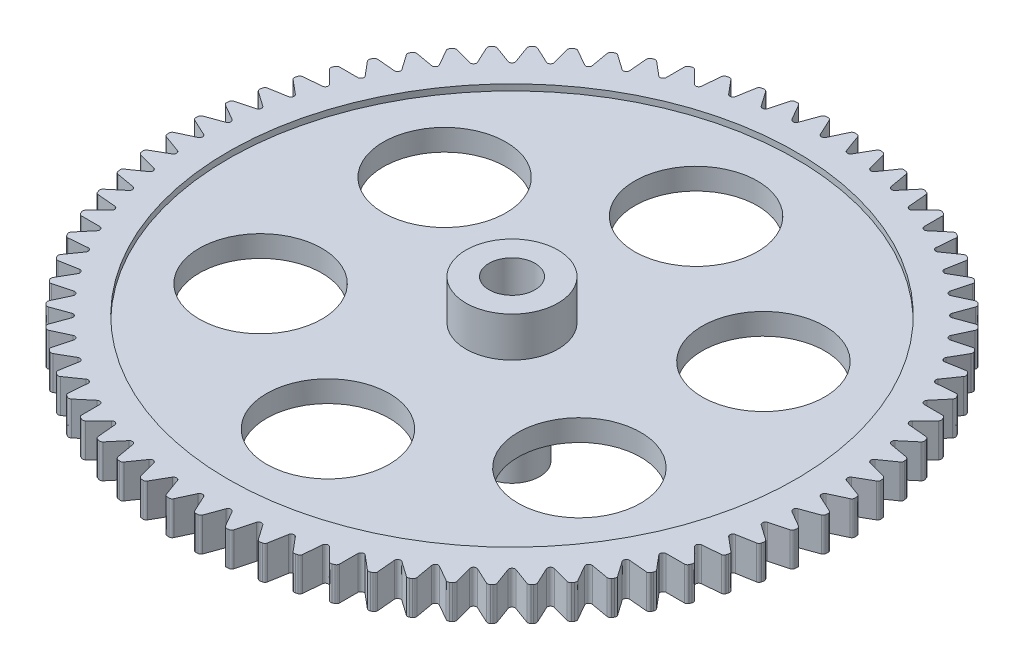
from build123d import *

# Parameters (mm, degrees)
CUT_EXTRUDE1_DEPTH  = 16.321063932
FILLET1_R           = 0.1
CIRPATTERN1_START   = 0.8
CIRPATTERN1_DEPTH   = 1.1
SKETCH3_R           = 2
CUT_EXTRUDE2_DEPTH  = 16.285192352
CIRPATTERN2_COUNT   = 6
BOSS_EXTRUDE1_START = -0.5
SKETCH6_R           = 1.5
SKETCH6_R_2         = 0.4
BOSS_EXTRUDE1_DEPTH = 0.5
BOSS_EXTRUDE2_START = 2.2
SKETCH7_R           = 0.9
SKETCH7_R_2         = 0.4
BOSS_EXTRUDE2_DEPTH = 2.2


# Read off the part's stored shape, not the designer's step: CirPattern1
with BuildPart() as part:
    # Sketch1 → Revolve1 (revolve)
    with BuildSketch(Plane.XY, mode=Mode.PRIVATE) as revolve1_sk:
        Polygon((0.5, 0), (0.5, 0.5), (0.75, 0.5), (0.75, 3), (1.5, 3), (1.5, 1.7), (9.25, 1.7), (9.25, 1.9), (10.75, 1.9), (10.75, 0.8), (9.25, 0.8), (9.25, 1), (1.5, 1), (1.5, 0), align=None)
    revolve(revolve1_sk.sketch.rotate(Axis((0, 55, 0), (0, -1, 0)), 90), axis=Axis((0, 55, 0), (0, -1, 0)))

    # Sketch2 → Cut-Extrude1 (cut, through all)
    with BuildSketch(Plane(origin=(0, 1.9, 0), x_dir=(1, 0, 0), z_dir=(0, 1, 0))):
        Polygon((-0.373046127, 10.75), (0, 9.95), (0.373046127, 10.75), align=None)
    extrude(amount=-CUT_EXTRUDE1_DEPTH, mode=Mode.SUBTRACT)

    # Fillet1
    fillet1_edges = [part.edges().sort_by_distance(p)[0] for p in [
        (0.370074857, 1.35, -10.743628093),
        (-0.370074857, 1.35, -10.743628093),
        (0, 1.35, -9.95),
    ]]
    fillet(fillet1_edges, radius=FILLET1_R)

    # CirPattern1 outline → CirPattern1 (cut)
    with BuildSketch(Plane(origin=(0, 0, 0), x_dir=(1, 0, 0), z_dir=(0, 1, 0)).offset(CIRPATTERN1_START)):
        with BuildLine():
            ThreePointArc((-7.947463997, -7.238806256), (-7.972392938, -7.186532724), (-7.964164878, -7.129206697))
            Line((-7.964164878, -7.129206697), (-7.712772988, -6.590095049))
            ThreePointArc((-7.712772988, -6.590095049), (-7.726799322, -6.483554461), (-7.829285671, -6.45124064))
            Line((-7.829285671, -6.45124064), (-8.403860746, -6.605197567))
            ThreePointArc((-8.403860746, -6.605197567), (-8.461744649, -6.603346064), (-8.508895164, -6.569718646))
            ThreePointArc((-8.508895164, -6.569718646), (-8.234977764, -6.909966804), (-7.947463997, -7.238806256))
        make_face()
        with BuildLine():
            ThreePointArc((1.271846931, 10.613006913), (1.314086242, 10.652627802), (1.371204865, 10.662190076))
            ThreePointArc((1.371204865, 10.662190076), (0.936924234, 10.709093004), (0.501096694, 10.738314677))
            ThreePointArc((0.501096694, 10.738314677), (0.555687086, 10.718979131), (0.590404592, 10.672625392))
            Line((0.590404592, 10.672625392), (0.793853184, 10.113654979))
            ThreePointArc((0.793853184, 10.113654979), (0.879106871, 10.048237523), (0.974424986, 10.097856993))
            Line((0.974424986, 10.097856993), (1.271846931, 10.613006913))
        make_face()
        with BuildLine():
            ThreePointArc((2.19199167, 10.461772453), (2.237523435, 10.497561175), (2.295258112, 10.502108845))
            ThreePointArc((2.295258112, 10.502108845), (1.86671791, 10.586683345), (1.435095662, 10.653778693))
            ThreePointArc((1.435095662, 10.653778693), (1.487793117, 10.629758858), (1.518338517, 10.58055568))
            Line((1.518338517, 10.58055568), (1.672295444, 10.005980604))
            ThreePointArc((1.672295444, 10.005980604), (1.75152321, 9.933381734), (1.850803232, 9.974504865))
            Line((1.850803232, 9.974504865), (2.19199167, 10.461772453))
        make_face()
        with BuildLine():
            ThreePointArc((3.095454028, 10.230917588), (3.143931724, 10.262601768), (3.201843059, 10.262100225))
            ThreePointArc((3.201843059, 10.262100225), (2.782304735, 10.383702632), (2.358172684, 10.48816102))
            ThreePointArc((2.358172684, 10.48816102), (2.408576143, 10.459639702), (2.43471697, 10.40796155))
            Line((2.43471697, 10.40796155), (2.538010527, 9.822154676))
            ThreePointArc((2.538010527, 9.822154676), (2.610609398, 9.742926911), (2.713095747, 9.775240733))
            Line((2.713095747, 9.775240733), (3.095454028, 10.230917588))
        make_face()
        with BuildLine():
            ThreePointArc((3.975358112, 9.922199263), (4.026412794, 9.949537766), (4.084060047, 9.943990825))
            ThreePointArc((4.084060047, 9.943990825), (3.676716541, 10.101695673), (3.263302589, 10.242722109))
            ThreePointArc((3.263302589, 10.242722109), (3.311028451, 10.209916373), (3.332565756, 10.156156548))
            Line((3.332565756, 10.156156548), (3.384409817, 9.563576219))
            ThreePointArc((3.384409817, 9.563576219), (3.449827272, 9.478322531), (3.554739965, 9.501581115))
            Line((3.554739965, 9.501581115), (3.975358112, 9.922199263))
        make_face()
        with BuildLine():
            ThreePointArc((4.825007321, 9.53796701), (4.878250432, 9.560751773), (4.935194872, 9.550201651))
            ThreePointArc((4.935194872, 9.550201651), (4.543146314, 9.74280871), (4.143596791, 9.919329898))
            ThreePointArc((4.143596791, 9.919329898), (4.188281833, 9.882489415), (4.205051704, 9.827057062))
            Line((4.205051704, 9.827057062), (4.205051704, 9.232213173))
            ThreePointArc((4.205051704, 9.232213173), (4.262789878, 9.141582394), (4.369330465, 9.155608729))
            Line((4.369330465, 9.155608729), (4.825007321, 9.53796701))
        make_face()
        with BuildLine():
            ThreePointArc((5.637935311, 9.08114507), (5.692961638, 9.099202686), (5.748769883, 9.083729676))
            ThreePointArc((5.748769883, 9.083729676), (5.375, 9.309773091), (4.992355719, 9.520445597))
            ThreePointArc((4.992355719, 9.520445597), (5.033659861, 9.479850745), (5.04553467, 9.423167739))
            Line((5.04553467, 9.423167739), (4.993690609, 8.83058741))
            ThreePointArc((4.993690609, 8.83058741), (5.043310079, 8.735269295), (5.150667723, 8.739956631))
            Line((5.150667723, 8.739956631), (5.637935311, 9.08114507))
        make_face()
        with BuildLine():
            ThreePointArc((6.407955208, 8.555210131), (6.464345969, 8.568403173), (6.518593285, 8.548125033))
            ThreePointArc((6.518593285, 8.548125033), (6.16594669, 8.805884476), (5.803119805, 9.049104957))
            ThreePointArc((5.803119805, 9.049104957), (5.840728699, 9.005064687), (5.847618071, 8.947562419))
            Line((5.847618071, 8.947562419), (5.744324514, 8.361755545))
            ThreePointArc((5.744324514, 8.361755545), (5.785447645, 8.262475523), (5.892805289, 8.257788187))
            Line((5.892805289, 8.257788187), (6.407955208, 8.555210131))
        make_face()
        with BuildLine():
            ThreePointArc((7.129206697, 7.964164878), (7.186532724, 7.972392938), (7.238806256, 7.947463997))
            ThreePointArc((7.238806256, 7.947463997), (6.909966804, 8.234977763), (6.569718646, 8.508895164))
            ThreePointArc((6.569718646, 8.508895164), (6.603346064, 8.461744649), (6.605197567, 8.403860746))
            Line((6.605197567, 8.403860746), (6.45124064, 7.829285671))
            ThreePointArc((6.45124064, 7.829285671), (6.483554461, 7.726799322), (6.590095049, 7.712772988))
            Line((6.590095049, 7.712772988), (7.129206697, 7.964164878))
        make_face()
        with BuildLine():
            ThreePointArc((7.796200619, 7.312507521), (7.854025625, 7.315707978), (7.903927541, 7.286317961))
            ThreePointArc((7.903927541, 7.286317961), (7.601397898, 7.601397898), (7.286317961, 7.903927541))
            ThreePointArc((7.286317961, 7.903927541), (7.315707978, 7.854025625), (7.312507521, 7.796200619))
            Line((7.312507521, 7.796200619), (7.109058929, 7.237230206))
            ThreePointArc((7.109058929, 7.237230206), (7.132317513, 7.132317513), (7.237230206, 7.109058929))
            Line((7.237230206, 7.109058929), (7.796200619, 7.312507521))
        make_face()
        with BuildLine():
            ThreePointArc((8.403860746, 6.605197567), (8.461744649, 6.603346064), (8.508895164, 6.569718646))
            ThreePointArc((8.508895164, 6.569718646), (8.234977763, 6.909966804), (7.947463997, 7.238806256))
            ThreePointArc((7.947463997, 7.238806256), (7.972392938, 7.186532724), (7.964164878, 7.129206697))
            Line((7.964164878, 7.129206697), (7.712772988, 6.590095049))
            ThreePointArc((7.712772988, 6.590095049), (7.726799322, 6.483554461), (7.829285671, 6.45124064))
            Line((7.829285671, 6.45124064), (8.403860746, 6.605197567))
        make_face()
        with BuildLine():
            ThreePointArc((8.947562419, 5.847618071), (9.005064687, 5.840728699), (9.049104957, 5.803119805))
            ThreePointArc((9.049104957, 5.803119805), (8.805884476, 6.16594669), (8.548125033, 6.518593285))
            ThreePointArc((8.548125033, 6.518593285), (8.568403173, 6.464345969), (8.555210131, 6.407955208))
            Line((8.555210131, 6.407955208), (8.257788187, 5.892805289))
            ThreePointArc((8.257788187, 5.892805289), (8.262475523, 5.785447645), (8.361755545, 5.744324514))
            Line((8.361755545, 5.744324514), (8.947562419, 5.847618071))
        make_face()
        with BuildLine():
            ThreePointArc((9.423167739, 5.04553467), (9.479850745, 5.033659861), (9.520445598, 4.992355719))
            ThreePointArc((9.520445598, 4.992355719), (9.309773091, 5.375), (9.083729676, 5.748769883))
            ThreePointArc((9.083729676, 5.748769883), (9.099202686, 5.692961638), (9.08114507, 5.637935311))
            Line((9.08114507, 5.637935311), (8.739956631, 5.150667723))
            ThreePointArc((8.739956631, 5.150667723), (8.735269295, 5.043310079), (8.83058741, 4.993690609))
            Line((8.83058741, 4.993690609), (9.423167739, 5.04553467))
        make_face()
        with BuildLine():
            ThreePointArc((9.827057062, 4.205051704), (9.882489415, 4.188281833), (9.919329899, 4.143596791))
            ThreePointArc((9.919329899, 4.143596791), (9.74280871, 4.543146314), (9.550201651, 4.935194872))
            ThreePointArc((9.550201651, 4.935194872), (9.560751773, 4.878250432), (9.53796701, 4.825007321))
            Line((9.53796701, 4.825007321), (9.155608729, 4.369330465))
            ThreePointArc((9.155608729, 4.369330465), (9.141582394, 4.262789878), (9.232213173, 4.205051704))
            Line((9.232213173, 4.205051704), (9.827057062, 4.205051704))
        make_face()
        with BuildLine():
            ThreePointArc((10.156156548, 3.332565756), (10.209916373, 3.311028451), (10.242722109, 3.263302589))
            ThreePointArc((10.242722109, 3.263302589), (10.101695673, 3.676716541), (9.943990825, 4.084060047))
            ThreePointArc((9.943990825, 4.084060047), (9.949537766, 4.026412794), (9.922199263, 3.975358112))
            Line((9.922199263, 3.975358112), (9.501581115, 3.554739965))
            ThreePointArc((9.501581115, 3.554739965), (9.478322531, 3.449827272), (9.563576219, 3.384409817))
            Line((9.563576219, 3.384409817), (10.156156548, 3.332565756))
        make_face()
        with BuildLine():
            ThreePointArc((10.40796155, 2.43471697), (10.459639702, 2.408576143), (10.48816102, 2.358172684))
            ThreePointArc((10.48816102, 2.358172684), (10.383702632, 2.782304735), (10.262100225, 3.201843059))
            ThreePointArc((10.262100225, 3.201843059), (10.262601768, 3.143931724), (10.230917588, 3.095454028))
            Line((10.230917588, 3.095454028), (9.775240733, 2.713095747))
            ThreePointArc((9.775240733, 2.713095747), (9.742926911, 2.610609398), (9.822154676, 2.538010527))
            Line((9.822154676, 2.538010527), (10.40796155, 2.43471697))
        make_face()
        with BuildLine():
            ThreePointArc((10.58055568, 1.518338517), (10.629758858, 1.487793117), (10.653778693, 1.435095662))
            ThreePointArc((10.653778693, 1.435095662), (10.586683345, 1.86671791), (10.502108845, 2.295258112))
            ThreePointArc((10.502108845, 2.295258112), (10.497561175, 2.237523435), (10.461772453, 2.19199167))
            Line((10.461772453, 2.19199167), (9.974504865, 1.850803232))
            ThreePointArc((9.974504865, 1.850803232), (9.933381734, 1.75152321), (10.005980604, 1.672295444))
            Line((10.005980604, 1.672295444), (10.58055568, 1.518338517))
        make_face()
        with BuildLine():
            ThreePointArc((10.672625392, 0.590404592), (10.718979131, 0.555687086), (10.738314677, 0.501096694))
            ThreePointArc((10.738314677, 0.501096694), (10.709093004, 0.936924234), (10.662190076, 1.371204865))
            ThreePointArc((10.662190076, 1.371204865), (10.652627802, 1.314086242), (10.613006913, 1.271846931))
            Line((10.613006913, 1.271846931), (10.097856993, 0.974424986))
            ThreePointArc((10.097856993, 0.974424986), (10.048237523, 0.879106871), (10.113654979, 0.793853184))
            Line((10.113654979, 0.793853184), (10.672625392, 0.590404592))
        make_face()
        with BuildLine():
            ThreePointArc((10.683469981, -0.342022669), (10.7266215, -0.380648058), (10.741125602, -0.436715922))
            ThreePointArc((10.741125602, -0.436715922), (10.75, 0), (10.741125602, 0.436715922))
            ThreePointArc((10.741125602, 0.436715922), (10.7266215, 0.380648058), (10.683469981, 0.342022669))
            Line((10.683469981, 0.342022669), (10.144358332, 0.090630779))
            ThreePointArc((10.144358332, 0.090630779), (10.086620158, 0), (10.144358332, -0.090630779))
            Line((10.144358332, -0.090630779), (10.683469981, -0.342022669))
        make_face()
        with BuildLine():
            ThreePointArc((10.613006913, -1.271846931), (10.652627802, -1.314086242), (10.662190076, -1.371204865))
            ThreePointArc((10.662190076, -1.371204865), (10.709093004, -0.936924234), (10.738314677, -0.501096694))
            ThreePointArc((10.738314677, -0.501096694), (10.718979131, -0.555687086), (10.672625392, -0.590404592))
            Line((10.672625392, -0.590404592), (10.113654979, -0.793853184))
            ThreePointArc((10.113654979, -0.793853184), (10.048237523, -0.879106871), (10.097856993, -0.974424986))
            Line((10.097856993, -0.974424986), (10.613006913, -1.271846931))
        make_face()
        with BuildLine():
            ThreePointArc((10.461772453, -2.19199167), (10.497561175, -2.237523435), (10.502108845, -2.295258112))
            ThreePointArc((10.502108845, -2.295258112), (10.586683345, -1.86671791), (10.653778693, -1.435095662))
            ThreePointArc((10.653778693, -1.435095662), (10.629758858, -1.487793117), (10.58055568, -1.518338517))
            Line((10.58055568, -1.518338517), (10.005980604, -1.672295444))
            ThreePointArc((10.005980604, -1.672295444), (9.933381734, -1.75152321), (9.974504865, -1.850803232))
            Line((9.974504865, -1.850803232), (10.461772453, -2.19199167))
        make_face()
        with BuildLine():
            ThreePointArc((10.230917588, -3.095454028), (10.262601768, -3.143931724), (10.262100225, -3.201843059))
            ThreePointArc((10.262100225, -3.201843059), (10.383702633, -2.782304735), (10.48816102, -2.358172684))
            ThreePointArc((10.48816102, -2.358172684), (10.459639702, -2.408576143), (10.40796155, -2.43471697))
            Line((10.40796155, -2.43471697), (9.822154676, -2.538010527))
            ThreePointArc((9.822154676, -2.538010527), (9.742926911, -2.610609398), (9.775240733, -2.713095747))
            Line((9.775240733, -2.713095747), (10.230917588, -3.095454028))
        make_face()
        with BuildLine():
            ThreePointArc((9.922199263, -3.975358112), (9.949537766, -4.026412794), (9.943990825, -4.084060047))
            ThreePointArc((9.943990825, -4.084060047), (10.101695673, -3.676716541), (10.242722109, -3.263302589))
            ThreePointArc((10.242722109, -3.263302589), (10.209916373, -3.311028451), (10.156156548, -3.332565756))
            Line((10.156156548, -3.332565756), (9.563576219, -3.384409817))
            ThreePointArc((9.563576219, -3.384409817), (9.478322531, -3.449827272), (9.501581115, -3.554739965))
            Line((9.501581115, -3.554739965), (9.922199263, -3.975358112))
        make_face()
        with BuildLine():
            ThreePointArc((9.53796701, -4.825007321), (9.560751773, -4.878250432), (9.550201651, -4.935194872))
            ThreePointArc((9.550201651, -4.935194872), (9.74280871, -4.543146314), (9.919329898, -4.143596791))
            ThreePointArc((9.919329898, -4.143596791), (9.882489415, -4.188281833), (9.827057062, -4.205051704))
            Line((9.827057062, -4.205051704), (9.232213173, -4.205051704))
            ThreePointArc((9.232213173, -4.205051704), (9.141582394, -4.262789878), (9.155608729, -4.369330465))
            Line((9.155608729, -4.369330465), (9.53796701, -4.825007321))
        make_face()
        with BuildLine():
            ThreePointArc((9.08114507, -5.637935311), (9.099202686, -5.692961638), (9.083729676, -5.748769883))
            ThreePointArc((9.083729676, -5.748769883), (9.309773091, -5.375), (9.520445598, -4.992355719))
            ThreePointArc((9.520445598, -4.992355719), (9.479850745, -5.033659861), (9.423167739, -5.04553467))
            Line((9.423167739, -5.04553467), (8.83058741, -4.993690609))
            ThreePointArc((8.83058741, -4.993690609), (8.735269295, -5.043310079), (8.739956631, -5.150667723))
            Line((8.739956631, -5.150667723), (9.08114507, -5.637935311))
        make_face()
        with BuildLine():
            ThreePointArc((8.555210131, -6.407955208), (8.568403173, -6.464345969), (8.548125033, -6.518593285))
            ThreePointArc((8.548125033, -6.518593285), (8.805884476, -6.165946691), (9.049104957, -5.803119805))
            ThreePointArc((9.049104957, -5.803119805), (9.005064687, -5.840728699), (8.947562419, -5.847618071))
            Line((8.947562419, -5.847618071), (8.361755545, -5.744324514))
            ThreePointArc((8.361755545, -5.744324514), (8.262475523, -5.785447645), (8.257788187, -5.892805289))
            Line((8.257788187, -5.892805289), (8.555210131, -6.407955208))
        make_face()
        with BuildLine():
            ThreePointArc((7.964164878, -7.129206697), (7.972392938, -7.186532724), (7.947463997, -7.238806256))
            ThreePointArc((7.947463997, -7.238806256), (8.234977764, -6.909966804), (8.508895164, -6.569718646))
            ThreePointArc((8.508895164, -6.569718646), (8.461744649, -6.603346064), (8.403860746, -6.605197567))
            Line((8.403860746, -6.605197567), (7.829285671, -6.45124064))
            ThreePointArc((7.829285671, -6.45124064), (7.726799322, -6.483554461), (7.712772988, -6.590095049))
            Line((7.712772988, -6.590095049), (7.964164878, -7.129206697))
        make_face()
        with BuildLine():
            ThreePointArc((7.312507521, -7.796200619), (7.315707978, -7.854025625), (7.286317961, -7.903927541))
            ThreePointArc((7.286317961, -7.903927541), (7.601397898, -7.601397898), (7.903927541, -7.286317961))
            ThreePointArc((7.903927541, -7.286317961), (7.854025625, -7.315707978), (7.796200619, -7.312507521))
            Line((7.796200619, -7.312507521), (7.237230206, -7.109058929))
            ThreePointArc((7.237230206, -7.109058929), (7.132317513, -7.132317513), (7.109058929, -7.237230206))
            Line((7.109058929, -7.237230206), (7.312507521, -7.796200619))
        make_face()
        with BuildLine():
            ThreePointArc((6.605197567, -8.403860746), (6.603346064, -8.461744649), (6.569718646, -8.508895164))
            ThreePointArc((6.569718646, -8.508895164), (6.909966804, -8.234977764), (7.238806256, -7.947463997))
            ThreePointArc((7.238806256, -7.947463997), (7.186532724, -7.972392938), (7.129206697, -7.964164878))
            Line((7.129206697, -7.964164878), (6.590095049, -7.712772988))
            ThreePointArc((6.590095049, -7.712772988), (6.483554461, -7.726799322), (6.45124064, -7.829285671))
            Line((6.45124064, -7.829285671), (6.605197567, -8.403860746))
        make_face()
        with BuildLine():
            ThreePointArc((5.847618071, -8.947562419), (5.840728699, -9.005064687), (5.803119805, -9.049104957))
            ThreePointArc((5.803119805, -9.049104957), (6.165946691, -8.805884476), (6.518593285, -8.548125033))
            ThreePointArc((6.518593285, -8.548125033), (6.464345969, -8.568403173), (6.407955208, -8.555210131))
            Line((6.407955208, -8.555210131), (5.892805289, -8.257788187))
            ThreePointArc((5.892805289, -8.257788187), (5.785447645, -8.262475523), (5.744324514, -8.361755545))
            Line((5.744324514, -8.361755545), (5.847618071, -8.947562419))
        make_face()
        with BuildLine():
            ThreePointArc((5.04553467, -9.423167739), (5.033659861, -9.479850745), (4.992355719, -9.520445598))
            ThreePointArc((4.992355719, -9.520445598), (5.375, -9.309773091), (5.748769883, -9.083729676))
            ThreePointArc((5.748769883, -9.083729676), (5.692961638, -9.099202686), (5.637935311, -9.08114507))
            Line((5.637935311, -9.08114507), (5.150667723, -8.739956631))
            ThreePointArc((5.150667723, -8.739956631), (5.043310079, -8.735269295), (4.993690609, -8.83058741))
            Line((4.993690609, -8.83058741), (5.04553467, -9.423167739))
        make_face()
        with BuildLine():
            ThreePointArc((4.205051704, -9.827057062), (4.188281833, -9.882489415), (4.143596791, -9.919329899))
            ThreePointArc((4.143596791, -9.919329899), (4.543146314, -9.742808711), (4.935194872, -9.550201651))
            ThreePointArc((4.935194872, -9.550201651), (4.878250432, -9.560751773), (4.825007321, -9.53796701))
            Line((4.825007321, -9.53796701), (4.369330465, -9.155608729))
            ThreePointArc((4.369330465, -9.155608729), (4.262789878, -9.141582394), (4.205051704, -9.232213173))
            Line((4.205051704, -9.232213173), (4.205051704, -9.827057062))
        make_face()
        with BuildLine():
            ThreePointArc((3.332565756, -10.156156548), (3.311028451, -10.209916373), (3.263302589, -10.242722109))
            ThreePointArc((3.263302589, -10.242722109), (3.676716541, -10.101695673), (4.084060047, -9.943990825))
            ThreePointArc((4.084060047, -9.943990825), (4.026412794, -9.949537766), (3.975358112, -9.922199263))
            Line((3.975358112, -9.922199263), (3.554739965, -9.501581115))
            ThreePointArc((3.554739965, -9.501581115), (3.449827272, -9.478322531), (3.384409817, -9.563576219))
            Line((3.384409817, -9.563576219), (3.332565756, -10.156156548))
        make_face()
        with BuildLine():
            ThreePointArc((2.43471697, -10.40796155), (2.408576143, -10.459639702), (2.358172684, -10.48816102))
            ThreePointArc((2.358172684, -10.48816102), (2.782304735, -10.383702633), (3.201843059, -10.262100225))
            ThreePointArc((3.201843059, -10.262100225), (3.143931724, -10.262601768), (3.095454028, -10.230917588))
            Line((3.095454028, -10.230917588), (2.713095747, -9.775240733))
            ThreePointArc((2.713095747, -9.775240733), (2.610609398, -9.742926911), (2.538010527, -9.822154676))
            Line((2.538010527, -9.822154676), (2.43471697, -10.40796155))
        make_face()
        with BuildLine():
            ThreePointArc((1.518338517, -10.58055568), (1.487793117, -10.629758858), (1.435095662, -10.653778693))
            ThreePointArc((1.435095662, -10.653778693), (1.86671791, -10.586683345), (2.295258112, -10.502108845))
            ThreePointArc((2.295258112, -10.502108845), (2.237523435, -10.497561175), (2.19199167, -10.461772453))
            Line((2.19199167, -10.461772453), (1.850803232, -9.974504865))
            ThreePointArc((1.850803232, -9.974504865), (1.75152321, -9.933381734), (1.672295444, -10.005980604))
            Line((1.672295444, -10.005980604), (1.518338517, -10.58055568))
        make_face()
        with BuildLine():
            ThreePointArc((0.590404592, -10.672625392), (0.555687086, -10.718979131), (0.501096694, -10.738314677))
            ThreePointArc((0.501096694, -10.738314677), (0.936924234, -10.709093005), (1.371204865, -10.662190076))
            ThreePointArc((1.371204865, -10.662190076), (1.314086242, -10.652627802), (1.271846931, -10.613006913))
            Line((1.271846931, -10.613006913), (0.974424986, -10.097856993))
            ThreePointArc((0.974424986, -10.097856993), (0.879106871, -10.048237523), (0.793853184, -10.113654979))
            Line((0.793853184, -10.113654979), (0.590404592, -10.672625392))
        make_face()
        with BuildLine():
            ThreePointArc((-0.342022669, -10.683469981), (-0.380648058, -10.7266215), (-0.436715922, -10.741125602))
            ThreePointArc((-0.436715922, -10.741125602), (0, -10.75), (0.436715922, -10.741125602))
            ThreePointArc((0.436715922, -10.741125602), (0.380648058, -10.7266215), (0.342022669, -10.683469981))
            Line((0.342022669, -10.683469981), (0.090630779, -10.144358332))
            ThreePointArc((0.090630779, -10.144358332), (0, -10.086620158), (-0.090630779, -10.144358332))
            Line((-0.090630779, -10.144358332), (-0.342022669, -10.683469981))
        make_face()
        with BuildLine():
            ThreePointArc((-1.271846931, -10.613006913), (-1.314086242, -10.652627802), (-1.371204865, -10.662190076))
            ThreePointArc((-1.371204865, -10.662190076), (-0.936924234, -10.709093005), (-0.501096694, -10.738314677))
            ThreePointArc((-0.501096694, -10.738314677), (-0.555687086, -10.718979131), (-0.590404592, -10.672625392))
            Line((-0.590404592, -10.672625392), (-0.793853184, -10.113654979))
            ThreePointArc((-0.793853184, -10.113654979), (-0.879106871, -10.048237523), (-0.974424986, -10.097856993))
            Line((-0.974424986, -10.097856993), (-1.271846931, -10.613006913))
        make_face()
        with BuildLine():
            ThreePointArc((-2.19199167, -10.461772453), (-2.237523435, -10.497561175), (-2.295258112, -10.502108845))
            ThreePointArc((-2.295258112, -10.502108845), (-1.86671791, -10.586683345), (-1.435095662, -10.653778693))
            ThreePointArc((-1.435095662, -10.653778693), (-1.487793117, -10.629758858), (-1.518338517, -10.58055568))
            Line((-1.518338517, -10.58055568), (-1.672295444, -10.005980604))
            ThreePointArc((-1.672295444, -10.005980604), (-1.75152321, -9.933381734), (-1.850803232, -9.974504865))
            Line((-1.850803232, -9.974504865), (-2.19199167, -10.461772453))
        make_face()
        with BuildLine():
            ThreePointArc((-3.095454028, -10.230917588), (-3.143931724, -10.262601768), (-3.201843059, -10.262100225))
            ThreePointArc((-3.201843059, -10.262100225), (-2.782304735, -10.383702633), (-2.358172684, -10.48816102))
            ThreePointArc((-2.358172684, -10.48816102), (-2.408576143, -10.459639702), (-2.43471697, -10.40796155))
            Line((-2.43471697, -10.40796155), (-2.538010527, -9.822154676))
            ThreePointArc((-2.538010527, -9.822154676), (-2.610609398, -9.742926911), (-2.713095747, -9.775240733))
            Line((-2.713095747, -9.775240733), (-3.095454028, -10.230917588))
        make_face()
        with BuildLine():
            ThreePointArc((-3.975358112, -9.922199263), (-4.026412794, -9.949537766), (-4.084060047, -9.943990825))
            ThreePointArc((-4.084060047, -9.943990825), (-3.676716541, -10.101695673), (-3.263302589, -10.242722109))
            ThreePointArc((-3.263302589, -10.242722109), (-3.311028451, -10.209916373), (-3.332565756, -10.156156548))
            Line((-3.332565756, -10.156156548), (-3.384409817, -9.563576219))
            ThreePointArc((-3.384409817, -9.563576219), (-3.449827272, -9.478322531), (-3.554739965, -9.501581115))
            Line((-3.554739965, -9.501581115), (-3.975358112, -9.922199263))
        make_face()
        with BuildLine():
            ThreePointArc((-4.825007321, -9.53796701), (-4.878250432, -9.560751773), (-4.935194872, -9.550201651))
            ThreePointArc((-4.935194872, -9.550201651), (-4.543146314, -9.742808711), (-4.143596791, -9.919329898))
            ThreePointArc((-4.143596791, -9.919329898), (-4.188281833, -9.882489415), (-4.205051704, -9.827057062))
            Line((-4.205051704, -9.827057062), (-4.205051704, -9.232213173))
            ThreePointArc((-4.205051704, -9.232213173), (-4.262789878, -9.141582394), (-4.369330465, -9.155608729))
            Line((-4.369330465, -9.155608729), (-4.825007321, -9.53796701))
        make_face()
        with BuildLine():
            ThreePointArc((-5.637935311, -9.08114507), (-5.692961638, -9.099202686), (-5.748769883, -9.083729676))
            ThreePointArc((-5.748769883, -9.083729676), (-5.375, -9.309773091), (-4.992355719, -9.520445598))
            ThreePointArc((-4.992355719, -9.520445598), (-5.033659861, -9.479850745), (-5.04553467, -9.423167739))
            Line((-5.04553467, -9.423167739), (-4.993690609, -8.83058741))
            ThreePointArc((-4.993690609, -8.83058741), (-5.043310079, -8.735269295), (-5.150667723, -8.739956631))
            Line((-5.150667723, -8.739956631), (-5.637935311, -9.08114507))
        make_face()
        with BuildLine():
            ThreePointArc((-6.407955208, -8.555210131), (-6.464345969, -8.568403173), (-6.518593285, -8.548125033))
            ThreePointArc((-6.518593285, -8.548125033), (-6.165946691, -8.805884476), (-5.803119805, -9.049104957))
            ThreePointArc((-5.803119805, -9.049104957), (-5.840728699, -9.005064687), (-5.847618071, -8.947562419))
            Line((-5.847618071, -8.947562419), (-5.744324514, -8.361755545))
            ThreePointArc((-5.744324514, -8.361755545), (-5.785447645, -8.262475523), (-5.892805289, -8.257788187))
            Line((-5.892805289, -8.257788187), (-6.407955208, -8.555210131))
        make_face()
        with BuildLine():
            ThreePointArc((-7.129206697, -7.964164878), (-7.186532724, -7.972392938), (-7.238806256, -7.947463997))
            ThreePointArc((-7.238806256, -7.947463997), (-6.909966804, -8.234977764), (-6.569718646, -8.508895164))
            ThreePointArc((-6.569718646, -8.508895164), (-6.603346064, -8.461744649), (-6.605197567, -8.403860746))
            Line((-6.605197567, -8.403860746), (-6.45124064, -7.829285671))
            ThreePointArc((-6.45124064, -7.829285671), (-6.483554461, -7.726799322), (-6.590095049, -7.712772988))
            Line((-6.590095049, -7.712772988), (-7.129206697, -7.964164878))
        make_face()
        with BuildLine():
            ThreePointArc((-7.796200619, -7.312507521), (-7.854025625, -7.315707978), (-7.903927541, -7.286317961))
            ThreePointArc((-7.903927541, -7.286317961), (-7.601397898, -7.601397898), (-7.286317961, -7.903927541))
            ThreePointArc((-7.286317961, -7.903927541), (-7.315707978, -7.854025625), (-7.312507521, -7.796200619))
            Line((-7.312507521, -7.796200619), (-7.109058929, -7.237230206))
            ThreePointArc((-7.109058929, -7.237230206), (-7.132317513, -7.132317513), (-7.237230206, -7.109058929))
            Line((-7.237230206, -7.109058929), (-7.796200619, -7.312507521))
        make_face()
        with BuildLine():
            ThreePointArc((-0.501096694, 10.738314677), (-0.936924234, 10.709093004), (-1.371204865, 10.662190076))
            ThreePointArc((-1.371204865, 10.662190076), (-1.314086242, 10.652627802), (-1.271846931, 10.613006913))
            Line((-1.271846931, 10.613006913), (-0.974424986, 10.097856993))
            ThreePointArc((-0.974424986, 10.097856993), (-0.879106871, 10.048237523), (-0.793853184, 10.113654979))
            Line((-0.793853184, 10.113654979), (-0.590404592, 10.672625392))
            ThreePointArc((-0.590404592, 10.672625392), (-0.555687086, 10.718979131), (-0.501096694, 10.738314677))
        make_face()
        with BuildLine():
            ThreePointArc((-1.435095662, 10.653778693), (-1.86671791, 10.586683345), (-2.295258112, 10.502108845))
            ThreePointArc((-2.295258112, 10.502108845), (-2.237523435, 10.497561175), (-2.19199167, 10.461772453))
            Line((-2.19199167, 10.461772453), (-1.850803232, 9.974504865))
            ThreePointArc((-1.850803232, 9.974504865), (-1.75152321, 9.933381734), (-1.672295444, 10.005980604))
            Line((-1.672295444, 10.005980604), (-1.518338517, 10.58055568))
            ThreePointArc((-1.518338517, 10.58055568), (-1.487793117, 10.629758858), (-1.435095662, 10.653778693))
        make_face()
        with BuildLine():
            ThreePointArc((-2.358172684, 10.48816102), (-2.782304735, 10.383702632), (-3.201843059, 10.262100225))
            ThreePointArc((-3.201843059, 10.262100225), (-3.143931724, 10.262601768), (-3.095454028, 10.230917588))
            Line((-3.095454028, 10.230917588), (-2.713095747, 9.775240733))
            ThreePointArc((-2.713095747, 9.775240733), (-2.610609398, 9.742926911), (-2.538010527, 9.822154676))
            Line((-2.538010527, 9.822154676), (-2.43471697, 10.40796155))
            ThreePointArc((-2.43471697, 10.40796155), (-2.408576143, 10.459639702), (-2.358172684, 10.48816102))
        make_face()
        with BuildLine():
            ThreePointArc((-3.263302589, 10.242722109), (-3.676716541, 10.101695673), (-4.084060047, 9.943990825))
            ThreePointArc((-4.084060047, 9.943990825), (-4.026412794, 9.949537766), (-3.975358112, 9.922199263))
            Line((-3.975358112, 9.922199263), (-3.554739965, 9.501581115))
            ThreePointArc((-3.554739965, 9.501581115), (-3.449827272, 9.478322531), (-3.384409817, 9.563576219))
            Line((-3.384409817, 9.563576219), (-3.332565756, 10.156156548))
            ThreePointArc((-3.332565756, 10.156156548), (-3.311028451, 10.209916373), (-3.263302589, 10.242722109))
        make_face()
        with BuildLine():
            ThreePointArc((-4.143596791, 9.919329898), (-4.543146314, 9.74280871), (-4.935194872, 9.550201651))
            ThreePointArc((-4.935194872, 9.550201651), (-4.878250432, 9.560751773), (-4.825007321, 9.53796701))
            Line((-4.825007321, 9.53796701), (-4.369330465, 9.155608729))
            ThreePointArc((-4.369330465, 9.155608729), (-4.262789878, 9.141582394), (-4.205051704, 9.232213173))
            Line((-4.205051704, 9.232213173), (-4.205051704, 9.827057062))
            ThreePointArc((-4.205051704, 9.827057062), (-4.188281833, 9.882489415), (-4.143596791, 9.919329898))
        make_face()
        with BuildLine():
            ThreePointArc((-4.992355719, 9.520445597), (-5.375, 9.309773091), (-5.748769883, 9.083729676))
            ThreePointArc((-5.748769883, 9.083729676), (-5.692961638, 9.099202686), (-5.637935311, 9.08114507))
            Line((-5.637935311, 9.08114507), (-5.150667723, 8.739956631))
            ThreePointArc((-5.150667723, 8.739956631), (-5.043310079, 8.735269295), (-4.993690609, 8.83058741))
            Line((-4.993690609, 8.83058741), (-5.04553467, 9.423167739))
            ThreePointArc((-5.04553467, 9.423167739), (-5.033659861, 9.479850745), (-4.992355719, 9.520445597))
        make_face()
        with BuildLine():
            ThreePointArc((-5.803119805, 9.049104957), (-6.16594669, 8.805884476), (-6.518593285, 8.548125033))
            ThreePointArc((-6.518593285, 8.548125033), (-6.464345969, 8.568403173), (-6.407955208, 8.555210131))
            Line((-6.407955208, 8.555210131), (-5.892805289, 8.257788187))
            ThreePointArc((-5.892805289, 8.257788187), (-5.785447645, 8.262475523), (-5.744324514, 8.361755545))
            Line((-5.744324514, 8.361755545), (-5.847618071, 8.947562419))
            ThreePointArc((-5.847618071, 8.947562419), (-5.840728699, 9.005064687), (-5.803119805, 9.049104957))
        make_face()
        with BuildLine():
            ThreePointArc((-6.569718646, 8.508895164), (-6.909966804, 8.234977763), (-7.238806256, 7.947463997))
            ThreePointArc((-7.238806256, 7.947463997), (-7.186532724, 7.972392938), (-7.129206697, 7.964164878))
            Line((-7.129206697, 7.964164878), (-6.590095049, 7.712772988))
            ThreePointArc((-6.590095049, 7.712772988), (-6.483554461, 7.726799322), (-6.45124064, 7.829285671))
            Line((-6.45124064, 7.829285671), (-6.605197567, 8.403860746))
            ThreePointArc((-6.605197567, 8.403860746), (-6.603346064, 8.461744649), (-6.569718646, 8.508895164))
        make_face()
        with BuildLine():
            ThreePointArc((-7.286317961, 7.903927541), (-7.601397898, 7.601397898), (-7.903927541, 7.286317961))
            ThreePointArc((-7.903927541, 7.286317961), (-7.854025625, 7.315707978), (-7.796200619, 7.312507521))
            Line((-7.796200619, 7.312507521), (-7.237230206, 7.109058929))
            ThreePointArc((-7.237230206, 7.109058929), (-7.132317513, 7.132317513), (-7.109058929, 7.237230206))
            Line((-7.109058929, 7.237230206), (-7.312507521, 7.796200619))
            ThreePointArc((-7.312507521, 7.796200619), (-7.315707978, 7.854025625), (-7.286317961, 7.903927541))
        make_face()
        with BuildLine():
            ThreePointArc((-7.947463997, 7.238806256), (-8.234977763, 6.909966804), (-8.508895164, 6.569718646))
            ThreePointArc((-8.508895164, 6.569718646), (-8.461744649, 6.603346064), (-8.403860746, 6.605197567))
            Line((-8.403860746, 6.605197567), (-7.829285671, 6.45124064))
            ThreePointArc((-7.829285671, 6.45124064), (-7.726799322, 6.483554461), (-7.712772988, 6.590095049))
            Line((-7.712772988, 6.590095049), (-7.964164878, 7.129206697))
            ThreePointArc((-7.964164878, 7.129206697), (-7.972392938, 7.186532724), (-7.947463997, 7.238806256))
        make_face()
        with BuildLine():
            ThreePointArc((-8.548125033, 6.518593285), (-8.805884476, 6.16594669), (-9.049104957, 5.803119805))
            ThreePointArc((-9.049104957, 5.803119805), (-9.005064687, 5.840728699), (-8.947562419, 5.847618071))
            Line((-8.947562419, 5.847618071), (-8.361755545, 5.744324514))
            ThreePointArc((-8.361755545, 5.744324514), (-8.262475523, 5.785447645), (-8.257788187, 5.892805289))
            Line((-8.257788187, 5.892805289), (-8.555210131, 6.407955208))
            ThreePointArc((-8.555210131, 6.407955208), (-8.568403173, 6.464345969), (-8.548125033, 6.518593285))
        make_face()
        with BuildLine():
            ThreePointArc((-9.083729676, 5.748769883), (-9.309773091, 5.375), (-9.520445597, 4.992355719))
            ThreePointArc((-9.520445597, 4.992355719), (-9.479850745, 5.033659861), (-9.423167739, 5.04553467))
            Line((-9.423167739, 5.04553467), (-8.83058741, 4.993690609))
            ThreePointArc((-8.83058741, 4.993690609), (-8.735269295, 5.043310079), (-8.739956631, 5.150667723))
            Line((-8.739956631, 5.150667723), (-9.08114507, 5.637935311))
            ThreePointArc((-9.08114507, 5.637935311), (-9.099202686, 5.692961638), (-9.083729676, 5.748769883))
        make_face()
        with BuildLine():
            ThreePointArc((-9.550201651, 4.935194872), (-9.74280871, 4.543146314), (-9.919329898, 4.143596791))
            ThreePointArc((-9.919329898, 4.143596791), (-9.882489415, 4.188281833), (-9.827057062, 4.205051704))
            Line((-9.827057062, 4.205051704), (-9.232213173, 4.205051704))
            ThreePointArc((-9.232213173, 4.205051704), (-9.141582394, 4.262789878), (-9.155608729, 4.369330465))
            Line((-9.155608729, 4.369330465), (-9.53796701, 4.825007321))
            ThreePointArc((-9.53796701, 4.825007321), (-9.560751773, 4.878250432), (-9.550201651, 4.935194872))
        make_face()
        with BuildLine():
            ThreePointArc((-9.943990825, 4.084060047), (-10.101695673, 3.676716541), (-10.242722109, 3.263302589))
            ThreePointArc((-10.242722109, 3.263302589), (-10.209916373, 3.311028451), (-10.156156548, 3.332565756))
            Line((-10.156156548, 3.332565756), (-9.563576219, 3.384409817))
            ThreePointArc((-9.563576219, 3.384409817), (-9.478322531, 3.449827272), (-9.501581115, 3.554739965))
            Line((-9.501581115, 3.554739965), (-9.922199263, 3.975358112))
            ThreePointArc((-9.922199263, 3.975358112), (-9.949537766, 4.026412794), (-9.943990825, 4.084060047))
        make_face()
        with BuildLine():
            ThreePointArc((-10.262100225, 3.201843059), (-10.383702632, 2.782304735), (-10.48816102, 2.358172684))
            ThreePointArc((-10.48816102, 2.358172684), (-10.459639702, 2.408576143), (-10.40796155, 2.43471697))
            Line((-10.40796155, 2.43471697), (-9.822154676, 2.538010527))
            ThreePointArc((-9.822154676, 2.538010527), (-9.742926911, 2.610609398), (-9.775240733, 2.713095747))
            Line((-9.775240733, 2.713095747), (-10.230917588, 3.095454028))
            ThreePointArc((-10.230917588, 3.095454028), (-10.262601768, 3.143931724), (-10.262100225, 3.201843059))
        make_face()
        with BuildLine():
            ThreePointArc((-10.502108845, 2.295258112), (-10.586683345, 1.86671791), (-10.653778693, 1.435095662))
            ThreePointArc((-10.653778693, 1.435095662), (-10.629758858, 1.487793117), (-10.58055568, 1.518338517))
            Line((-10.58055568, 1.518338517), (-10.005980604, 1.672295444))
            ThreePointArc((-10.005980604, 1.672295444), (-9.933381734, 1.75152321), (-9.974504865, 1.850803232))
            Line((-9.974504865, 1.850803232), (-10.461772453, 2.19199167))
            ThreePointArc((-10.461772453, 2.19199167), (-10.497561175, 2.237523435), (-10.502108845, 2.295258112))
        make_face()
        with BuildLine():
            ThreePointArc((-10.662190076, 1.371204865), (-10.709093004, 0.936924234), (-10.738314677, 0.501096694))
            ThreePointArc((-10.738314677, 0.501096694), (-10.718979131, 0.555687086), (-10.672625392, 0.590404592))
            Line((-10.672625392, 0.590404592), (-10.113654979, 0.793853184))
            ThreePointArc((-10.113654979, 0.793853184), (-10.048237523, 0.879106871), (-10.097856993, 0.974424986))
            Line((-10.097856993, 0.974424986), (-10.613006913, 1.271846931))
            ThreePointArc((-10.613006913, 1.271846931), (-10.652627802, 1.314086242), (-10.662190076, 1.371204865))
        make_face()
        with BuildLine():
            ThreePointArc((-10.741125602, 0.436715922), (-10.75, 0), (-10.741125602, -0.436715922))
            ThreePointArc((-10.741125602, -0.436715922), (-10.7266215, -0.380648058), (-10.683469981, -0.342022669))
            Line((-10.683469981, -0.342022669), (-10.144358332, -0.090630779))
            ThreePointArc((-10.144358332, -0.090630779), (-10.086620158, 0), (-10.144358332, 0.090630779))
            Line((-10.144358332, 0.090630779), (-10.683469981, 0.342022669))
            ThreePointArc((-10.683469981, 0.342022669), (-10.7266215, 0.380648058), (-10.741125602, 0.436715922))
        make_face()
        with BuildLine():
            ThreePointArc((-10.738314677, -0.501096694), (-10.709093004, -0.936924234), (-10.662190076, -1.371204865))
            ThreePointArc((-10.662190076, -1.371204865), (-10.652627802, -1.314086242), (-10.613006913, -1.271846931))
            Line((-10.613006913, -1.271846931), (-10.097856993, -0.974424986))
            ThreePointArc((-10.097856993, -0.974424986), (-10.048237523, -0.879106871), (-10.113654979, -0.793853184))
            Line((-10.113654979, -0.793853184), (-10.672625392, -0.590404592))
            ThreePointArc((-10.672625392, -0.590404592), (-10.718979131, -0.555687086), (-10.738314677, -0.501096694))
        make_face()
        with BuildLine():
            ThreePointArc((-10.653778693, -1.435095662), (-10.586683345, -1.86671791), (-10.502108845, -2.295258112))
            ThreePointArc((-10.502108845, -2.295258112), (-10.497561175, -2.237523435), (-10.461772453, -2.19199167))
            Line((-10.461772453, -2.19199167), (-9.974504865, -1.850803232))
            ThreePointArc((-9.974504865, -1.850803232), (-9.933381734, -1.75152321), (-10.005980604, -1.672295444))
            Line((-10.005980604, -1.672295444), (-10.58055568, -1.518338517))
            ThreePointArc((-10.58055568, -1.518338517), (-10.629758858, -1.487793117), (-10.653778693, -1.435095662))
        make_face()
        with BuildLine():
            ThreePointArc((-10.48816102, -2.358172684), (-10.383702633, -2.782304735), (-10.262100225, -3.201843059))
            ThreePointArc((-10.262100225, -3.201843059), (-10.262601768, -3.143931724), (-10.230917588, -3.095454028))
            Line((-10.230917588, -3.095454028), (-9.775240733, -2.713095747))
            ThreePointArc((-9.775240733, -2.713095747), (-9.742926911, -2.610609398), (-9.822154676, -2.538010527))
            Line((-9.822154676, -2.538010527), (-10.40796155, -2.43471697))
            ThreePointArc((-10.40796155, -2.43471697), (-10.459639702, -2.408576143), (-10.48816102, -2.358172684))
        make_face()
        with BuildLine():
            ThreePointArc((-10.242722109, -3.263302589), (-10.101695673, -3.676716541), (-9.943990825, -4.084060047))
            ThreePointArc((-9.943990825, -4.084060047), (-9.949537766, -4.026412794), (-9.922199263, -3.975358112))
            Line((-9.922199263, -3.975358112), (-9.501581115, -3.554739965))
            ThreePointArc((-9.501581115, -3.554739965), (-9.478322531, -3.449827272), (-9.563576219, -3.384409817))
            Line((-9.563576219, -3.384409817), (-10.156156548, -3.332565756))
            ThreePointArc((-10.156156548, -3.332565756), (-10.209916373, -3.311028451), (-10.242722109, -3.263302589))
        make_face()
        with BuildLine():
            ThreePointArc((-9.919329898, -4.143596791), (-9.74280871, -4.543146314), (-9.550201651, -4.935194872))
            ThreePointArc((-9.550201651, -4.935194872), (-9.560751773, -4.878250432), (-9.53796701, -4.825007321))
            Line((-9.53796701, -4.825007321), (-9.155608729, -4.369330465))
            ThreePointArc((-9.155608729, -4.369330465), (-9.141582394, -4.262789878), (-9.232213173, -4.205051704))
            Line((-9.232213173, -4.205051704), (-9.827057062, -4.205051704))
            ThreePointArc((-9.827057062, -4.205051704), (-9.882489415, -4.188281833), (-9.919329898, -4.143596791))
        make_face()
        with BuildLine():
            ThreePointArc((-9.520445598, -4.992355719), (-9.309773091, -5.375), (-9.083729676, -5.748769883))
            ThreePointArc((-9.083729676, -5.748769883), (-9.099202686, -5.692961638), (-9.08114507, -5.637935311))
            Line((-9.08114507, -5.637935311), (-8.739956631, -5.150667723))
            ThreePointArc((-8.739956631, -5.150667723), (-8.735269295, -5.043310079), (-8.83058741, -4.993690609))
            Line((-8.83058741, -4.993690609), (-9.423167739, -5.04553467))
            ThreePointArc((-9.423167739, -5.04553467), (-9.479850745, -5.033659861), (-9.520445598, -4.992355719))
        make_face()
        with BuildLine():
            ThreePointArc((-9.049104957, -5.803119805), (-8.805884476, -6.165946691), (-8.548125033, -6.518593285))
            ThreePointArc((-8.548125033, -6.518593285), (-8.568403173, -6.464345969), (-8.555210131, -6.407955208))
            Line((-8.555210131, -6.407955208), (-8.257788187, -5.892805289))
            ThreePointArc((-8.257788187, -5.892805289), (-8.262475523, -5.785447645), (-8.361755545, -5.744324514))
            Line((-8.361755545, -5.744324514), (-8.947562419, -5.847618071))
            ThreePointArc((-8.947562419, -5.847618071), (-9.005064687, -5.840728699), (-9.049104957, -5.803119805))
        make_face()
    extrude(amount=CIRPATTERN1_DEPTH, mode=Mode.SUBTRACT)

    # Sketch3 → Cut-Extrude2 (cut, through all)
    with BuildSketch(Plane(origin=(0, 1.7, 0), x_dir=(1, 0, 0), z_dir=(0, 1, 0))):
        with Locations(Location((0, 6, 0), (0, 0, 270))):
            Circle(SKETCH3_R)
    cut_extrude2 = extrude(amount=-CUT_EXTRUDE2_DEPTH, mode=Mode.SUBTRACT)

    # CirPattern2: Cut-Extrude2 ×6 about axis
    cirpattern2_axis = Axis((0, 0, 0), (0, 1, 0))
    for i in range(1, CIRPATTERN2_COUNT):
        add(cut_extrude2.rotate(cirpattern2_axis, i * 360 / CIRPATTERN2_COUNT), mode=Mode.SUBTRACT)

    # Sketch6 → Boss-Extrude1 (add)
    with BuildSketch(Plane(origin=(0, 0.5, 0), x_dir=(1, 0, 0), z_dir=(0, 1, 0)).offset(BOSS_EXTRUDE1_START)):
        with Locations(Location((0, 0, 0), (0, 0, 270))):
            Circle(SKETCH6_R)
        with Locations(Location((0, 0.02682203, 0), (0, 0, 270))):
            Circle(SKETCH6_R_2, mode=Mode.SUBTRACT)
    extrude(amount=BOSS_EXTRUDE1_DEPTH)

    # Sketch7 → Boss-Extrude2 (add)
    with BuildSketch(Plane.XZ.offset(BOSS_EXTRUDE2_START)):
        with Locations(Location((0, 0, 0), (0, 0, 90))):
            Circle(SKETCH7_R)
        with Locations(Location((0, -0.02682203, 0), (0, 0, 90))):
            Circle(SKETCH7_R_2, mode=Mode.SUBTRACT)
    extrude(amount=-BOSS_EXTRUDE2_DEPTH)


solid = part.part
